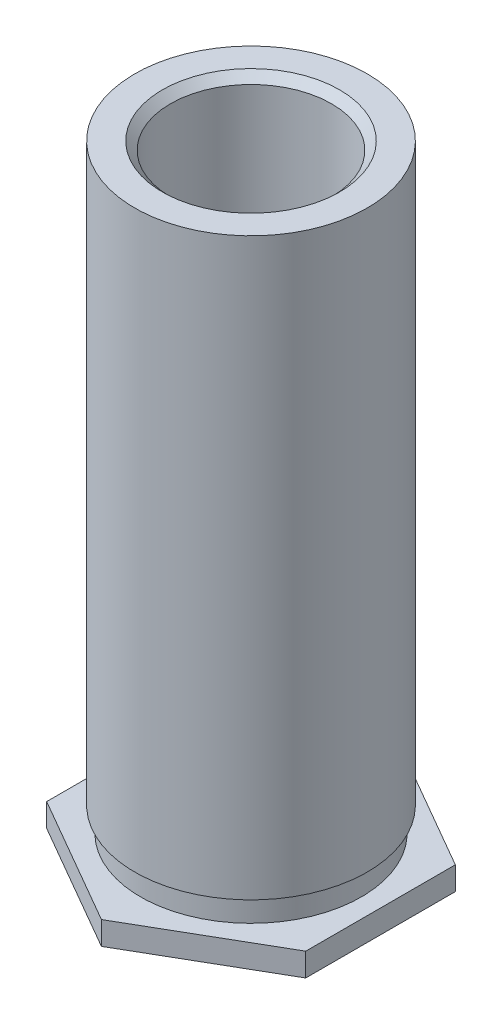
from build123d import *

# Parameters (mm, degrees)
HEXDIESKE_R  = 4.609084
HEXDIE_DEPTH = 0.7112


with BuildPart() as part:
    # BodySke → Body (revolve)
    with BuildSketch(Plane.XY):
        Polygon((3.556, 0), (4.596384, 0), (4.596384, 0.7112), (3.3782, 0.7112), (3.3782, 1.45796), (3.556, 1.45796), (3.556, 19.05), (2.71018, 19.05), (2.4638, 18.80362), (2.4638, 0.25146), (2.71018, 0.00508), (3.556, 0.00508), align=None)
    revolve(axis=Axis((0, 0, 0), (0, 1, 0)))

    # HexDieSke → HexDie (cut)
    with BuildSketch(Plane(origin=(0, 0.7112, 0), x_dir=(-1, 0, 0), z_dir=(0, 1, 0))):
        Circle(HEXDIESKE_R)
        Polygon((0, 4.575385413), (3.9624, 2.287692707), (3.9624, -2.287692707), (0, -4.575385413), (-3.9624, -2.287692707), (-3.9624, 2.287692707), align=None, mode=Mode.SUBTRACT)
    extrude(amount=-HEXDIE_DEPTH, mode=Mode.SUBTRACT)


solid = part.part
